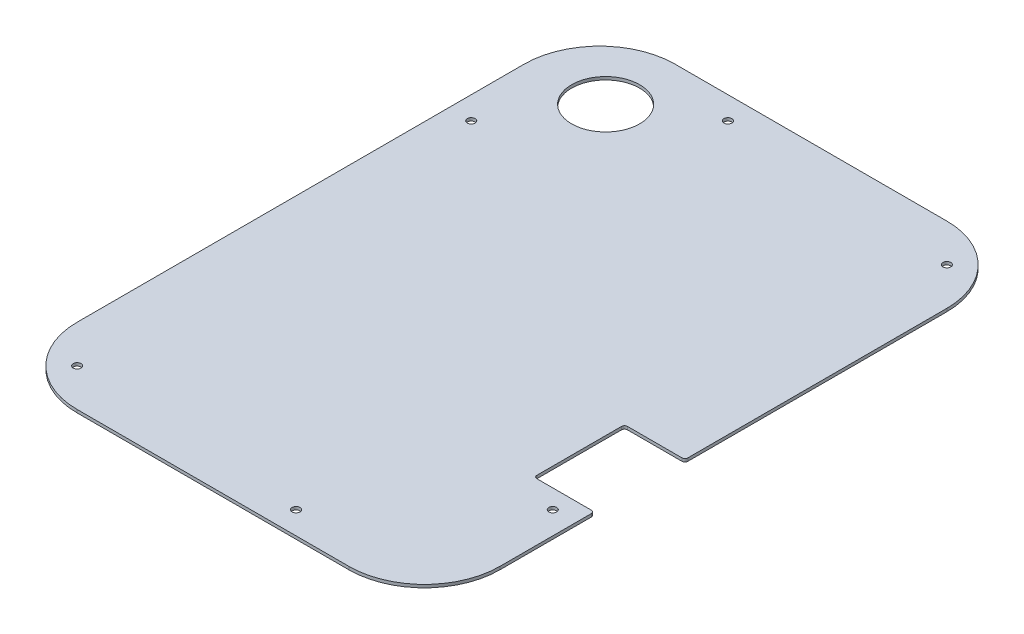
from build123d import *

# Parameters (mm, degrees)
SKETCH1_W             = 280
SKETCH1_H             = 396
BASE_FLANGE1_DEPTH    = 2
BREAK_CORNER1_START   = -2
BREAK_CORNER1_DEPTH   = 2
SKETCH2_R             = 22.5
CUT_EXTRUDE1_DEPTH    = 243.503608221
SKETCH3_R             = 2.6
CUT_EXTRUDE2_DEPTH    = 243.503608221
SKETCH4_W             = 40
SKETCH4_H             = 60
CUT_EXTRUDE3_DEPTH    = 243.503608221
BREAK_CORNER2_START   = -2
BREAK_CORNER2_DEPTH   = 2
BREAK_CORNER2_2_DEPTH = 2


# Read off the part's stored shape, not the designer's step: Break-Corner1, Break-Corner2
# Sheet-metal steps are written as plain solids
with BuildPart() as part:
    # Sketch1 → Base-Flange1 (new body)
    with BuildSketch(Plane(origin=(0, 0, 0), x_dir=(1, 0, 0), z_dir=(0, 1, 0))):
        Rectangle(SKETCH1_W, SKETCH1_H)
    extrude(amount=-BASE_FLANGE1_DEPTH)

    # Break-Corner1 outline → Break-Corner1 (cut)
    with BuildSketch(Plane(origin=(0, 0, 0), x_dir=(1, 0, 0), z_dir=(0, 1, 0)).offset(BREAK_CORNER1_START)):
        with BuildLine():
            ThreePointArc((-140, 148), (-125.355339059, 183.355339059), (-90, 198))
            Line((-90, 198), (-140, 198))
            Line((-140, 198), (-140, 148))
        make_face()
        with BuildLine():
            Line((140, 198), (90, 198))
            ThreePointArc((90, 198), (125.355339059, 183.355339059), (140, 148))
            Line((140, 148), (140, 198))
        make_face()
        with BuildLine():
            ThreePointArc((-90, -198), (-125.355339059, -183.355339059), (-140, -148))
            Line((-140, -148), (-140, -198))
            Line((-140, -198), (-90, -198))
        make_face()
        with BuildLine():
            Line((140, -198), (140, -148))
            ThreePointArc((140, -148), (125.355339059, -183.355339059), (90, -198))
            Line((90, -198), (140, -198))
        make_face()
    extrude(amount=BREAK_CORNER1_DEPTH, mode=Mode.SUBTRACT)

    # Sketch2 → Cut-Extrude1 (cut, through all)
    with BuildSketch(Plane(origin=(0, 0, 0), x_dir=(1, 0, 0), z_dir=(0, 1, 0))):
        with Locations(Location((-90, 152, 0), (0, 0, 270))):
            Circle(SKETCH2_R)
    extrude(amount=-CUT_EXTRUDE1_DEPTH, mode=Mode.SUBTRACT)

    # Sketch3 → Cut-Extrude2 (cut, through all)
    with BuildSketch(Plane(origin=(0, 0, 0), x_dir=(1, 0, 0), z_dir=(0, 1, 0))):
        with Locations(Location((-40, 183, 0), (0, 0, 270))):
            Circle(SKETCH3_R)
        with Locations(Location((-125, 98, 0), (0, 0, 270))):
            Circle(SKETCH3_R)
        with Locations(Location((125, -98, 0), (0, 0, 270))):
            Circle(SKETCH3_R)
        with Locations(Location((40, -183, 0), (0, 0, 270))):
            Circle(SKETCH3_R)
        with Locations(Location((-115, -173, 0), (0, 0, 270))):
            Circle(SKETCH3_R)
        with Locations(Location((115, 173, 0), (0, 0, 270))):
            Circle(SKETCH3_R)
    extrude(amount=-CUT_EXTRUDE2_DEPTH, mode=Mode.SUBTRACT)

    # Sketch4 → Cut-Extrude3 (cut, through all)
    with BuildSketch(Plane(origin=(0, 0, 0), x_dir=(1, 0, 0), z_dir=(0, 1, 0))):
        with Locations((120, -55.5)):
            Rectangle(SKETCH4_W, SKETCH4_H)
    extrude(amount=-CUT_EXTRUDE3_DEPTH, mode=Mode.SUBTRACT)

    # Break-Corner2 outline → Break-Corner2 (cut)
    with BuildSketch(Plane(origin=(0, 0, 0), x_dir=(1, 0, 0), z_dir=(0, 1, 0)).offset(BREAK_CORNER2_START)):
        with BuildLine():
            Line((140, -85.5), (138, -85.5))
            ThreePointArc((138, -85.5), (139.414213562, -86.085786438), (140, -87.5))
            Line((140, -87.5), (140, -85.5))
        make_face()
        with BuildLine():
            ThreePointArc((140, -23.5), (139.414213562, -24.914213562), (138, -25.5))
            Line((138, -25.5), (140, -25.5))
            Line((140, -25.5), (140, -23.5))
        make_face()
    extrude(amount=BREAK_CORNER2_DEPTH, mode=Mode.SUBTRACT)

    # Break-Corner2 2 outline → Break-Corner2 2 (add)
    with BuildSketch(Plane(origin=(0, 0, 0), x_dir=(1, 0, 0), z_dir=(0, 1, 0)).offset(BREAK_CORNER2_START)):
        with BuildLine():
            Line((100, -25.5), (100, -27.5))
            ThreePointArc((100, -27.5), (100.585786438, -26.085786438), (102, -25.5))
            Line((102, -25.5), (100, -25.5))
        make_face()
        with BuildLine():
            ThreePointArc((102, -85.5), (100.585786438, -84.914213562), (100, -83.5))
            Line((100, -83.5), (100, -85.5))
            Line((100, -85.5), (102, -85.5))
        make_face()
    extrude(amount=BREAK_CORNER2_2_DEPTH)


solid = part.part
